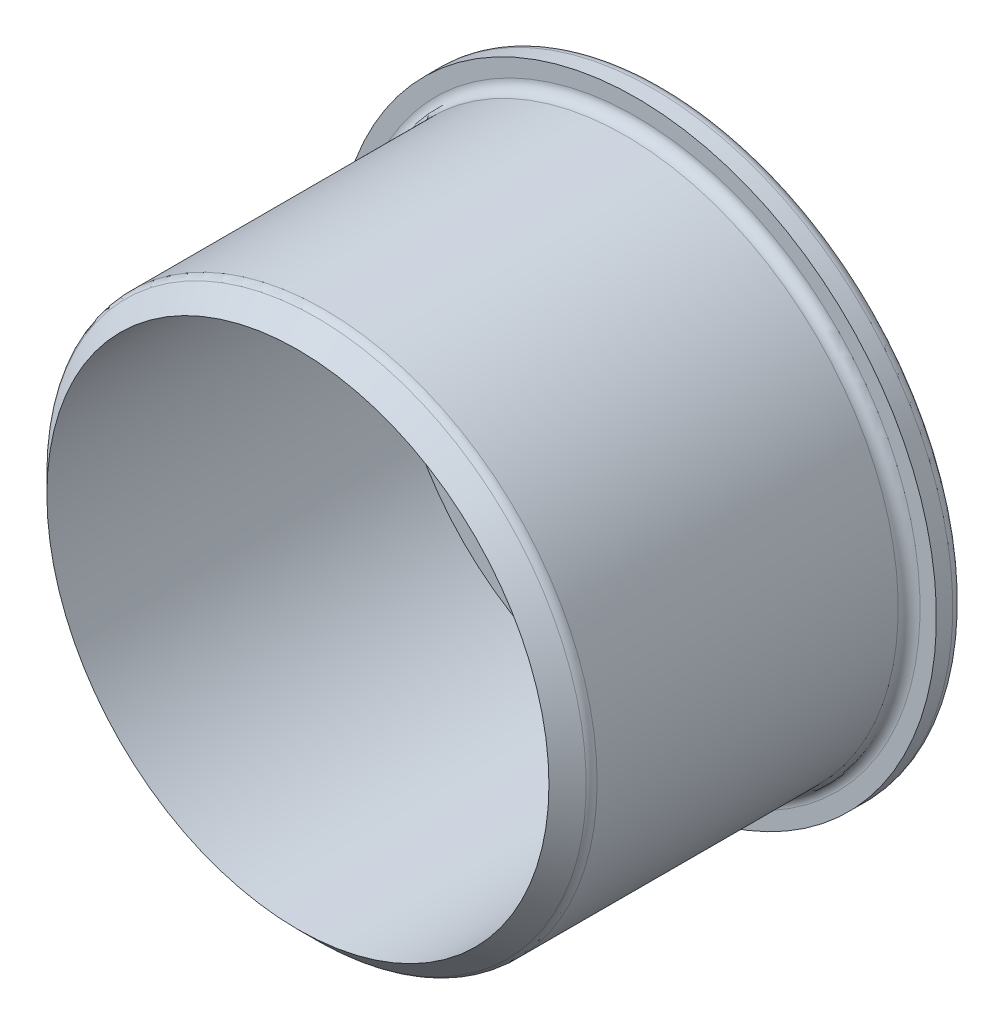
from build123d import *

# Parameters (mm, degrees)
SKETCH_1_R          = 25
EXTRUDE_1_DEPTH     = 32
SKETCH_2_R          = 27.5
EXTRUDE_2_DEPTH     = 2.5
SKETCH_3_R          = 23
CUT_EXTRUDE_1_DEPTH = 32.5
CHAMFER_1_SIZE      = 3
FILLET_1_R          = 1
FILLET_2_R          = 1
FILLET_3_R          = 1
SKETCH_4_R          = 1.6
CUT_EXTRUDE_2_DEPTH = 32.5
SKETCH_5_R          = 7
CUT_EXTRUDE_3_DEPTH = 10


with BuildPart() as part:
    # Эскиз1 → Бобышка-Вытянуть1 (new body)
    with BuildSketch(Plane.XY):
        Circle(SKETCH_1_R)
    extrude(amount=EXTRUDE_1_DEPTH)

    # Эскиз2 → Бобышка-Вытянуть2 (add)
    with BuildSketch(Plane(origin=(0, 0, 0), x_dir=(-1, 0, 0), z_dir=(0, 0, -1))):
        Circle(SKETCH_2_R)
    extrude(amount=EXTRUDE_2_DEPTH)

    # Эскиз3 → Вырез-Вытянуть1 (cut)
    with BuildSketch(Plane.XY.offset(32)):
        Circle(SKETCH_3_R)
    extrude(amount=-CUT_EXTRUDE_1_DEPTH, mode=Mode.SUBTRACT)

    # Фаска1
    # the kernel refuses this chamfer: 3 mm, written as the material it takes off along each edge
    with BuildSketch(Plane(origin=(0, 0, 32), x_dir=(1, 0, 0), z_dir=(0, -1, 0))) as chamfer_1_piece_1:
        Polygon((25, -CHAMFER_1_SIZE), (25 - CHAMFER_1_SIZE, 0), (25, 0), align=None)
    revolve(axis=Axis((0, 0, 32), (0, 0, 1)), mode=Mode.SUBTRACT)

    # Скругление1
    fillet_1_edges = [part.edges().sort_by_distance(p)[0] for p in [
        (-25, 0, 29),
    ]]
    fillet(fillet_1_edges, radius=FILLET_1_R)

    # Скругление2
    fillet_2_edges = [part.edges().sort_by_distance(p)[0] for p in [
        (-25, 0, 0),
    ]]
    fillet(fillet_2_edges, radius=FILLET_2_R)

    # Скругление3
    fillet_3_edges = [part.edges().sort_by_distance(p)[0] for p in [
        (27.5, 0, -2.5),
    ]]
    fillet(fillet_3_edges, radius=FILLET_3_R)

    # Эскиз4 → Вырез-Вытянуть2 (cut)
    with BuildSketch(Plane(origin=(0, 0, -2.5), x_dir=(-1, 0, 0), z_dir=(0, 0, -1))):
        Circle(SKETCH_4_R)
    extrude(amount=-CUT_EXTRUDE_2_DEPTH, mode=Mode.SUBTRACT)

    # Эскиз5 → Вырез-Вытянуть3 (cut)
    with BuildSketch(Plane(origin=(0, 0, -2.5), x_dir=(-1, 0, 0), z_dir=(0, 0, -1))):
        Circle(SKETCH_5_R)
    extrude(amount=-CUT_EXTRUDE_3_DEPTH, mode=Mode.SUBTRACT)


solid = part.part
